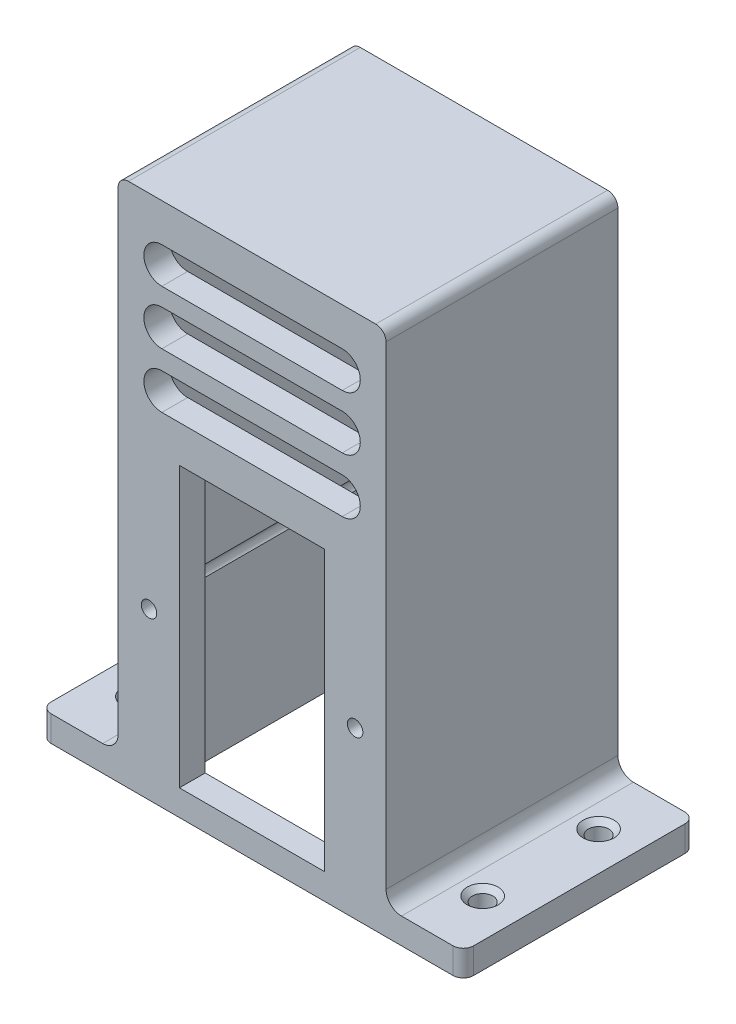
from build123d import *

# Parameters (mm, degrees)
RESSALTO_EXTRUS_O4_DEPTH = 5
RESSALTO_EXTRUS_O6_DEPTH = 102
ESBO_O9_W                = 52
ESBO_O9_H                = 5
RESSALTO_EXTRUS_O7_DEPTH = 45
ESBO_O10_R               = 2
CORTE_EXTRUS_O1_DEPTH    = 119.785521003
FILETE1_R                = 3
FILETE2_R                = 3
FILETE3_R                = 2
FILETE5_R                = 2
FILETE6_R                = 2
ESBO_O11_R               = 1.5
ESBO_O11_W               = 28.2
ESBO_O11_H               = 54.2
CORTE_EXTRUS_O2_DEPTH    = 119.785521003
CORTE_EXTRUS_O3_DEPTH    = 119.785521003
CHANFRO1_SIZE            = 1
CHANFRO2_SIZE            = 1


with BuildPart() as part:
    # Esboço7 → Ressalto-extrusão4 (new body)
    with BuildSketch(Plane(origin=(0, 0, 0), x_dir=(1, 0, 0), z_dir=(0, 1, 0))):
        Polygon((41, 0), (41, 45), (21, 45), (21, 5), (-21, 5), (-21, 45), (-41, 45), (-41, 0), align=None)
    extrude(amount=RESSALTO_EXTRUS_O4_DEPTH)

    # Esboço8 → Ressalto-extrusão6 (add)
    with BuildSketch(Plane(origin=(0, 0, 0), x_dir=(1, 0, 0), z_dir=(0, 1, 0))):
        Polygon((-21, 45), (-26, 45), (-26, 0), (26, 0), (26, 45), (21, 45), (21, 5), (-21, 5), align=None)
    extrude(amount=RESSALTO_EXTRUS_O6_DEPTH)

    # Esboço9 → Ressalto-extrusão7 (add)
    with BuildSketch(Plane.XY):
        with Locations((0, 99.5)):
            Rectangle(ESBO_O9_W, ESBO_O9_H)
    extrude(amount=-RESSALTO_EXTRUS_O7_DEPTH)

    # Esboço10 → Corte-extrusão1 (cut, through all)
    with BuildSketch(Plane(origin=(0, 0, 0), x_dir=(1, 0, 0), z_dir=(0, 1, 0))):
        with Locations((-33.5, 33.75)):
            Circle(ESBO_O10_R)
        with Locations((-33.5, 11.25)):
            Circle(ESBO_O10_R)
        with Locations((33.5, 11.25)):
            Circle(ESBO_O10_R)
        with Locations((33.5, 33.75)):
            Circle(ESBO_O10_R)
    extrude(amount=CORTE_EXTRUS_O1_DEPTH, mode=Mode.SUBTRACT)

    # Filete1
    filete1_edges = [part.edges().sort_by_distance(p)[0] for p in [
        (26, 5, -22.5),
    ]]
    fillet(filete1_edges, radius=FILETE1_R)

    # Filete2
    filete2_edges = [part.edges().sort_by_distance(p)[0] for p in [
        (-26, 5, -22.5),
    ]]
    fillet(filete2_edges, radius=FILETE2_R)

    # Filete3
    filete3_edges = [part.edges().sort_by_distance(p)[0] for p in [
        (41, 2.5, 0),
        (41, 2.5, -45),
        (-41, 2.5, 0),
        (-41, 2.5, -45),
    ]]
    fillet(filete3_edges, radius=FILETE3_R)

    # Filete5
    filete5_edges = [part.edges().sort_by_distance(p)[0] for p in [
        (26, 102, -22.5),
    ]]
    fillet(filete5_edges, radius=FILETE5_R)

    # Filete6
    filete6_edges = [part.edges().sort_by_distance(p)[0] for p in [
        (-26, 102, -22.5),
    ]]
    fillet(filete6_edges, radius=FILETE6_R)

    # Esboço11 → Corte-extrusão2 (cut, through all)
    with BuildSketch(Plane.XY):
        with Locations((20, 32.1)):
            Circle(ESBO_O11_R)
        with Locations((-20, 32.1)):
            Circle(ESBO_O11_R)
        with Locations((0, 32.1)):
            Rectangle(ESBO_O11_W, ESBO_O11_H)
    extrude(amount=-CORTE_EXTRUS_O2_DEPTH, mode=Mode.SUBTRACT)

    # Esboço12 → Corte-extrusão3 (cut, through all)
    with BuildSketch(Plane.XY):
        with BuildLine():
            Line((-17.5, 94.595561983), (17.5, 94.595561983))
            ThreePointArc((17.5, 94.595561983), (21, 91.095561983), (17.5, 87.595561983))
            Line((17.5, 87.595561983), (-17.5, 87.595561983))
            ThreePointArc((-17.5, 87.595561983), (-21, 91.095561983), (-17.5, 94.595561983))
        make_face()
        with BuildLine():
            Line((-17.5, 84.1), (17.5, 84.1))
            ThreePointArc((17.5, 84.1), (21, 80.6), (17.5, 77.1))
            Line((17.5, 77.1), (-17.5, 77.1))
            ThreePointArc((-17.5, 77.1), (-21, 80.6), (-17.5, 84.1))
        make_face()
        with BuildLine():
            Line((-17.5, 73.4), (17.5, 73.4))
            ThreePointArc((17.5, 73.4), (21, 69.9), (17.5, 66.4))
            Line((17.5, 66.4), (-17.5, 66.4))
            ThreePointArc((-17.5, 66.4), (-21, 69.9), (-17.5, 73.4))
        make_face()
    extrude(amount=-CORTE_EXTRUS_O3_DEPTH, mode=Mode.SUBTRACT)

    # Chanfro1
    chanfro1_edges = [part.edges().sort_by_distance(p)[0] for p in [
        (31.5, 5, -11.25),
        (31.5, 5, -33.75),
    ]]
    chamfer(chanfro1_edges, length=CHANFRO1_SIZE)

    # Chanfro2
    chanfro2_edges = [part.edges().sort_by_distance(p)[0] for p in [
        (-35.5, 5, -33.75),
        (-35.5, 5, -11.25),
    ]]
    chamfer(chanfro2_edges, length=CHANFRO2_SIZE)


solid = part.part
